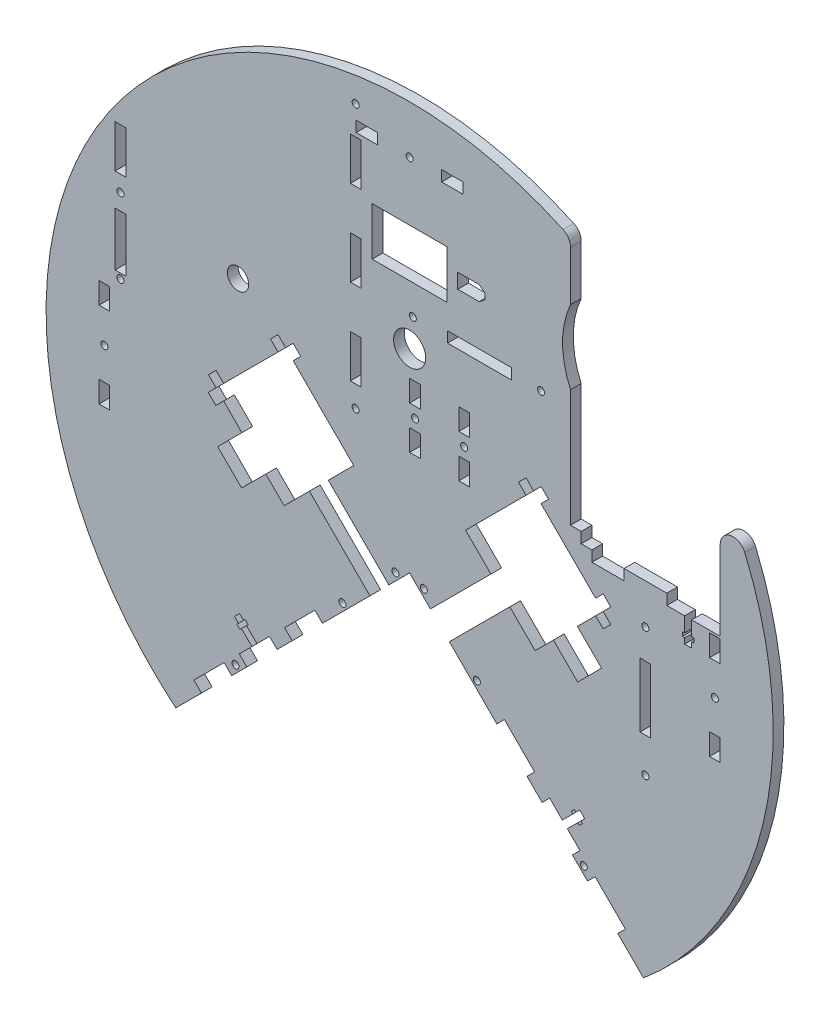
from build123d import *

# Parameters (mm, degrees)
SKETCH1_R                               = 215.9
BOSS_EXTRUDE1_DEPTH                     = 6.35
CUT_EXTRUDE1_DEPTH                      = 306.394732273
CUT_EXTRUDE2_DEPTH                      = 306.394732273
SKETCH4_W                               = 6.35
SKETCH4_H                               = 12.7
CUT_EXTRUDE3_DEPTH                      = 306.394732273
CUT_EXTRUDE4_DEPTH                      = 6.35
LPATTERN1_COUNT                         = 3
LPATTERN1_PITCH                         = 38.1
CUT_EXTRUDE5_DEPTH                      = 6.35
LPATTERN2_COUNT                         = 3
LPATTERN2_PITCH                         = 38.1
SKETCH8_W                               = 6.35
SKETCH8_H                               = 25.4
SKETCH8_H_2                             = 31.84481566
CUT_EXTRUDE7_DEPTH                      = 306.394732273
SKETCH11_R                              = 2.0955
WHEEL_HOLE_DEPTH                        = 306.394732273
SKETCH12_W                              = 44.45
SKETCH12_H                              = 28.575
BATTERY_HOLE_DEPTH                      = 306.394732273
SKETCH13_R                              = 2.0955
CUT_EXTRUDE10_DEPTH                     = 306.394732273
SKETCH14_R                              = 2.0955
CUT_EXTRUDE11_DEPTH                     = 306.394732273
SKETCH15_R                              = 2.0955
CUT_EXTRUDE12_DEPTH                     = 306.394732273
XT60BATTERYHOLE_DEPTH                   = 306.394732273
SKETCH22_R                              = 9.525
WIRE_HOLE_FOR_SERVO_AND_TOP_COMPS_DEPTH = 306.394732273
SKETCH23_W                              = 6.35
SKETCH23_H                              = 12.7
CAMERAMOUNTTABHOLES_DEPTH               = 306.394732273
SKETCH24_R                              = 2.0955
CUT_EXTRUDE18_DEPTH                     = 306.394732273
SKETCH25_W                              = 12.7
SKETCH25_H                              = 6.35
CUT_EXTRUDE19_DEPTH                     = 306.394732273
SKETCH26_R                              = 2.0955
CUT_EXTRUDE20_DEPTH                     = 306.394732273
CUT_EXTRUDE24_DEPTH                     = 306.394732273
CUT_EXTRUDE25_DEPTH                     = 306.394732273
CUT_EXTRUDE28_DEPTH                     = 306.394732273
FILLET2_R                               = 7.62
SKETCH36_W                              = 6.35
SKETCH36_H                              = 12.7
BOSS_EXTRUDE8_DEPTH                     = 6.35
SKETCH37_W                              = 6.35
SKETCH37_H                              = 6.35
BOSS_EXTRUDE9_DEPTH                     = 6.35
CUT_EXTRUDE29_DEPTH                     = 306.394732273
CUT_EXTRUDE30_DEPTH                     = 306.394732273
SKETCH40_W                              = 25.389250947
SKETCH40_H                              = 6.35
BOSS_EXTRUDE10_DEPTH                    = 6.35
CUT_EXTRUDE31_DEPTH                     = 306.394732273
SKETCH42_W                              = 6.35
SKETCH42_H                              = 38.1
CUT_EXTRUDE32_DEPTH                     = 306.394732273
SKETCH43_R                              = 2.0955
CUT_EXTRUDE33_DEPTH                     = 306.394732273
SKETCH44_R                              = 2.0955
CUT_EXTRUDE34_DEPTH                     = 306.394732273
SKETCH45_W                              = 38.1
SKETCH45_H                              = 6.35
CUT_EXTRUDE35_DEPTH                     = 306.394732273
SKETCH46_R                              = 6.35
CUT_EXTRUDE36_DEPTH                     = 306.394732273


with BuildPart() as part:
    # Sketch1 → Boss-Extrude1 (new body)
    with BuildSketch(Plane.XY):
        Circle(SKETCH1_R)
    extrude(amount=BOSS_EXTRUDE1_DEPTH)

    # Sketch2 → Cut-Extrude1 (cut, through all)
    with BuildSketch(Plane(origin=(0, 0, 0), x_dir=(-1, 0, 0), z_dir=(0, 0, -1))):
        with BuildLine():
            Line((0, -26.441092948), (138.870288723, -165.311381671))
            ThreePointArc((138.870288723, -165.311381671), (0, -215.9), (-138.870288723, -165.311381671))
            Line((-138.870288723, -165.311381671), (0, -26.441092948))
        make_face()
    extrude(amount=-CUT_EXTRUDE1_DEPTH, mode=Mode.SUBTRACT)

    # Sketch3 → Cut-Extrude2 (cut, through all)
    with BuildSketch(Plane.XY.offset(6.35)):
        Polygon((73.638100193, 52.585160918), (33.226947648, 12.174008373), (48.268876651, -2.86792063), (12.347852166, -38.788945114), (23.573172318, -50.014265265), (59.494196802, -14.093240781), (74.536125805, -29.135169784), (114.94727835, 11.275982761), align=None)
    cut_extrude2 = extrude(amount=-CUT_EXTRUDE2_DEPTH, mode=Mode.SUBTRACT)

    # Mirror1: Cut-Extrude2 across plane
    add(cut_extrude2.mirror(Plane(origin=(0, 0, 0), x_dir=(0, 0, 1), z_dir=(1, 0, 0))), mode=Mode.SUBTRACT)

    # Sketch4 → Cut-Extrude3 (cut, through all)
    with BuildSketch(Plane.XY.offset(6.35)):
        with Locations((181.263437852, -25.4)):
            Rectangle(SKETCH4_W, SKETCH4_H)
        with Locations((181.263437852, 25.4)):
            Rectangle(SKETCH4_W, SKETCH4_H)
        with Locations((-181.263437852, 25.4)):
            Rectangle(SKETCH4_W, SKETCH4_H)
        with Locations((-181.263437852, -25.4)):
            Rectangle(SKETCH4_W, SKETCH4_H)
    extrude(amount=-CUT_EXTRUDE3_DEPTH, mode=Mode.SUBTRACT)

    # Sketch5 → Cut-Extrude4 (cut)
    with BuildSketch(Plane.XY.offset(6.35)):
        Polygon((-128.10574744, -145.566584266), (-110.145235198, -127.606072024), (-105.655107137, -132.096200085), (-123.615619379, -150.056712327), align=None)
    cut_extrude4 = extrude(amount=-CUT_EXTRUDE4_DEPTH, mode=Mode.SUBTRACT)

    # LPattern1: Cut-Extrude4 ×3
    with Locations(*[Vector(0.7071067811865477, 0.7071067811865475, 0) * (i * LPATTERN1_PITCH) for i in range(1, LPATTERN1_COUNT)]):
        add(cut_extrude4, mode=Mode.SUBTRACT)

    # Sketch6 → Cut-Extrude5 (cut)
    with BuildSketch(Plane.XY.offset(6.35)):
        Polygon((110.145235198, -127.606072024), (128.10574744, -145.566584266), (123.615619379, -150.056712327), (105.655107137, -132.096200085), align=None)
    cut_extrude5 = extrude(amount=-CUT_EXTRUDE5_DEPTH, mode=Mode.SUBTRACT)

    # LPattern2: Cut-Extrude5 ×3
    with Locations(*[Vector(-0.7071067811865489, 0.7071067811865461, 0) * (i * LPATTERN2_PITCH) for i in range(1, LPATTERN2_COUNT)]):
        add(cut_extrude5, mode=Mode.SUBTRACT)

    # Sketch8 → Cut-Extrude7 (cut, through all)
    with BuildSketch(Plane(origin=(0, 0, 0), x_dir=(-1, 0, 0), z_dir=(0, 0, -1))):
        with Locations((32.038437852, 169.033338138)):
            Rectangle(SKETCH8_W, SKETCH8_H)
        with Locations((32.038437852, 118.233338138)):
            Rectangle(SKETCH8_W, SKETCH8_H)
        with Locations((32.038437852, 67.433338138)):
            Rectangle(SKETCH8_W, SKETCH8_H)
        with Locations((171.738437852, 105.533338138)):
            Rectangle(SKETCH8_W, SKETCH8_H)
        with Locations((171.738437852, 57.860930308)):
            Rectangle(SKETCH8_W, SKETCH8_H_2)
    extrude(amount=-CUT_EXTRUDE7_DEPTH, mode=Mode.SUBTRACT)

    # Sketch11 → Wheel Hole (cut, through all)
    with BuildSketch(Plane(origin=(0, 0, 0), x_dir=(-1, 0, 0), z_dir=(0, 0, -1))):
        with Locations((181.263437852, 0)):
            Circle(SKETCH11_R)
    wheel_hole = extrude(amount=-WHEEL_HOLE_DEPTH, mode=Mode.SUBTRACT)

    # Mirror2: Wheel Hole across plane
    add(wheel_hole.mirror(Plane(origin=(0, 0, 0), x_dir=(0, 0, 1), z_dir=(1, 0, 0))), mode=Mode.SUBTRACT)

    # Sketch12 → Battery hole (cut, through all)
    with BuildSketch(Plane.XY.offset(6.35)):
        with Locations((0, 138.1125)):
            Rectangle(SKETCH12_W, SKETCH12_H)
    extrude(amount=-BATTERY_HOLE_DEPTH, mode=Mode.SUBTRACT)

    # Sketch13 → Cut-Extrude10 (cut, through all)
    with BuildSketch(Plane(origin=(0, 0, 0), x_dir=(-1, 0, 0), z_dir=(0, 0, -1))):
        with Locations((103.410043107, -125.361007994)):
            Circle(SKETCH13_R)
        with Locations((39.918435395, -61.869400282)):
            Circle(SKETCH13_R)
        with Locations((8.418990113, -30.369955001)):
            Circle(SKETCH13_R)
    cut_extrude10 = extrude(amount=-CUT_EXTRUDE10_DEPTH, mode=Mode.SUBTRACT)

    # Mirror3: Cut-Extrude10 across plane
    add(cut_extrude10.mirror(Plane(origin=(0, 0, 0), x_dir=(0, 0, 1), z_dir=(1, 0, 0))), mode=Mode.SUBTRACT)

    # Sketch14 → Cut-Extrude11 (cut, through all)
    with BuildSketch(Plane.XY.offset(6.35)):
        with Locations((-171.738437852, 83.308338138)):
            Circle(SKETCH14_R)
        with Locations((-171.738437852, 38.858338138)):
            Circle(SKETCH14_R)
    extrude(amount=-CUT_EXTRUDE11_DEPTH, mode=Mode.SUBTRACT)

    # Sketch15 → Cut-Extrude12 (cut, through all)
    with BuildSketch(Plane.XY.offset(6.35)):
        with Locations((-32.038437852, 42.033338138)):
            Circle(SKETCH15_R)
        with Locations((-32.038437852, 198.816669069)):
            Circle(SKETCH15_R)
    extrude(amount=-CUT_EXTRUDE12_DEPTH, mode=Mode.SUBTRACT)

    # Sketch21 → XT60BatteryHole (cut, through all)
    with BuildSketch(Plane.XY.offset(6.35)):
        Polygon((44.831, 139.79525), (41.275, 142.494), (28.575, 142.494), (28.575, 133.731), (41.275, 133.731), (44.831, 136.42975), align=None)
    extrude(amount=-XT60BATTERYHOLE_DEPTH, mode=Mode.SUBTRACT)

    # Sketch22 → Wire Hole for Servo and Top Comps. (cut, through all)
    with BuildSketch(Plane.XY.offset(6.35)):
        with Locations((0, 88.9)):
            Circle(SKETCH22_R)
    extrude(amount=-WIRE_HOLE_FOR_SERVO_AND_TOP_COMPS_DEPTH, mode=Mode.SUBTRACT)

    # Sketch23 → CameraMountTabHoles (cut, through all)
    with BuildSketch(Plane(origin=(0, 0, 0), x_dir=(-1, 0, 0), z_dir=(0, 0, -1))):
        with Locations((-32.385, 41.91)):
            Rectangle(SKETCH23_W, SKETCH23_H)
        with Locations((-32.385, 67.31)):
            Rectangle(SKETCH23_W, SKETCH23_H)
        with Locations((-3.175, 41.91)):
            Rectangle(SKETCH23_W, SKETCH23_H)
        with Locations((-3.175, 67.31)):
            Rectangle(SKETCH23_W, SKETCH23_H)
    extrude(amount=-CAMERAMOUNTTABHOLES_DEPTH, mode=Mode.SUBTRACT)

    # Sketch24 → Cut-Extrude18 (cut, through all)
    with BuildSketch(Plane.XY.offset(6.35)):
        with Locations((32.385, 54.61)):
            Circle(SKETCH24_R)
        with Locations((3.175, 54.61)):
            Circle(SKETCH24_R)
    extrude(amount=-CUT_EXTRUDE18_DEPTH, mode=Mode.SUBTRACT)

    # Sketch25 → Cut-Extrude19 (cut, through all)
    with BuildSketch(Plane.XY.offset(6.35)):
        with Locations((-25.4, 187.325)):
            Rectangle(SKETCH25_W, SKETCH25_H)
        with Locations((25.4, 187.325)):
            Rectangle(SKETCH25_W, SKETCH25_H)
    extrude(amount=-CUT_EXTRUDE19_DEPTH, mode=Mode.SUBTRACT)

    # Sketch26 → Cut-Extrude20 (cut, through all)
    with BuildSketch(Plane(origin=(0, 0, 0), x_dir=(-1, 0, 0), z_dir=(0, 0, -1))):
        with Locations((0, 187.325)):
            Circle(SKETCH26_R)
    extrude(amount=-CUT_EXTRUDE20_DEPTH, mode=Mode.SUBTRACT)

    # Sketch30 → Cut-Extrude24 (cut, through all)
    with BuildSketch(Plane.XY.offset(6.35)):
        Polygon((-93.666465216, -111.127302042), (-90.702980696, -108.163817522), (-96.899357419, -101.967440799), (-95.956430526, -101.024513906), (-97.752481751, -99.228462682), (-98.695408643, -100.171389574), (-101.030275235, -97.836522983), (-103.993759755, -100.800007503), (-101.658893163, -103.134874094), (-102.601820056, -104.077800987), (-100.805768832, -105.873852211), (-99.862841939, -104.930925319), align=None)
    cut_extrude24 = extrude(amount=-CUT_EXTRUDE24_DEPTH, mode=Mode.SUBTRACT)

    # Mirror4: Cut-Extrude24 across plane
    add(cut_extrude24.mirror(Plane(origin=(0, 0, 0), x_dir=(0, 0, 1), z_dir=(1, 0, 0))), mode=Mode.SUBTRACT)

    # Sketch31 → Cut-Extrude25 (cut, through all)
    with BuildSketch(Plane.XY.offset(6.35)):
        Polygon((-99.591040383, -4.080255206), (-85.402235711, -18.269059877), (-99.770645505, -32.637469671), (-113.959450176, -18.448665), align=None)
        Polygon((99.591040383, -4.080255206), (85.402235711, -18.269059877), (99.770645505, -32.637469671), (113.959450176, -18.448665), align=None)
    extrude(amount=-CUT_EXTRUDE25_DEPTH, mode=Mode.SUBTRACT)

    # Sketch35 → Cut-Extrude28 (cut, through all)
    with BuildSketch(Plane.XY.offset(6.35)):
        with BuildLine():
            Line((95.538437852, 33.17632042), (184.438437852, 33.17632042))
            Line((184.438437852, 33.17632042), (184.438437852, 116.87632042))
            ThreePointArc((184.438437852, 116.87632042), (146.330419618, 164.308887008), (95.538437852, 197.808797679))
            Line((95.538437852, 197.808797679), (95.538437852, 121.87632042))
            Line((95.538437852, 121.87632042), (95.538437852, 33.17632042))
        make_face()
    extrude(amount=-CUT_EXTRUDE28_DEPTH, mode=Mode.SUBTRACT)

    # Fillet2
    fillet2_edges = [part.edges().sort_by_distance(p)[0] for p in [
        (184.438437852, 112.228662305, 3.175),
        (95.538437852, 193.610993729, 3.175),
    ]]
    fillet(fillet2_edges, radius=FILLET2_R)

    # Sketch36 → Boss-Extrude8 (add)
    with BuildSketch(Plane(origin=(95.538437852, 0, 0), x_dir=(0, 0, -1), z_dir=(1, 0, 0))):
        with Locations((-3.175, 39.52632042)):
            Rectangle(SKETCH36_W, SKETCH36_H)
    extrude(amount=BOSS_EXTRUDE8_DEPTH)

    # Sketch37 → Boss-Extrude9 (add)
    with BuildSketch(Plane(origin=(101.888437852, 0, 0), x_dir=(0, 0, -1), z_dir=(1, 0, 0))):
        with Locations((-3.175, 36.35132042)):
            Rectangle(SKETCH37_W, SKETCH37_H)
    extrude(amount=BOSS_EXTRUDE9_DEPTH)

    # Sketch38 → Cut-Extrude29 (cut, through all)
    with BuildSketch(Plane.XY.offset(6.35)):
        with BuildLine():
            Line((95.538437852, 159.30810977), (95.538437852, 115.573937206))
            ThreePointArc((95.538437852, 115.573937206), (90.813693084, 137.441023488), (95.538437852, 159.30810977))
        make_face()
    extrude(amount=-CUT_EXTRUDE29_DEPTH, mode=Mode.SUBTRACT)

    # Sketch39 → Cut-Extrude30 (cut, through all)
    with BuildSketch(Plane.XY.offset(6.35)):
        Polygon((119.43740641, 6.7858547), (114.94727835, 11.275982761), (110.457150289, 6.7858547), (114.94727835, 2.29572664), align=None)
        Polygon((110.457150289, 15.766110821), (114.94727835, 11.275982761), (119.43740641, 15.766110821), (114.94727835, 20.256238882), align=None)
        Polygon((78.128228253, 57.075288978), (73.638100193, 52.585160918), (78.001430205, 48.221830906), (82.491558265, 52.711958966), align=None)
        Polygon((69.147972132, 48.095032857), (73.638100193, 52.585160918), (69.147972132, 57.075288978), (64.657844072, 52.585160918), align=None)
        Polygon((-69.147972132, 57.075288978), (-73.638100193, 52.585160918), (-69.147972132, 48.095032857), (-64.657844072, 52.585160918), align=None)
        Polygon((-78.128228253, 48.095032857), (-73.638100193, 52.585160918), (-78.128228253, 57.075288978), (-82.618356314, 52.585160918), align=None)
        Polygon((-119.43740641, 15.766110821), (-114.94727835, 11.275982761), (-110.457150289, 15.766110821), (-114.94727835, 20.256238882), align=None)
        Polygon((-110.457150289, 6.7858547), (-114.94727835, 11.275982761), (-119.565782853, 6.657478257), (-115.075654793, 2.167350197), align=None)
    extrude(amount=-CUT_EXTRUDE30_DEPTH, mode=Mode.SUBTRACT)

    # Sketch40 → Boss-Extrude10 (add)
    with BuildSketch(Plane(origin=(0, 33.17632042, 0), x_dir=(1, 0, 0), z_dir=(0, 1, 0))):
        with Locations((139.993812379, -3.175)):
            Rectangle(SKETCH40_W, SKETCH40_H)
    extrude(amount=BOSS_EXTRUDE10_DEPTH)

    # Sketch41 → Cut-Extrude31 (cut, through all)
    with BuildSketch(Plane.XY.offset(6.35)):
        Polygon((167.483937852, 33.17632042), (163.292937852, 33.17632042), (163.292937852, 24.41332042), (161.959437852, 24.41332042), (161.959437852, 21.87332042), (163.292937852, 21.87332042), (163.292937852, 18.57132042), (167.483937852, 18.57132042), (167.483937852, 21.87332042), (168.817437852, 21.87332042), (168.817437852, 24.41332042), (167.483937852, 24.41332042), align=None)
    extrude(amount=-CUT_EXTRUDE31_DEPTH, mode=Mode.SUBTRACT)

    # Sketch42 → Cut-Extrude32 (cut, through all)
    with BuildSketch(Plane(origin=(0, 0, 0), x_dir=(-1, 0, 0), z_dir=(0, 0, -1))):
        with Locations((-139.988437852, -20.79867958)):
            Rectangle(SKETCH42_W, SKETCH42_H)
    extrude(amount=-CUT_EXTRUDE32_DEPTH, mode=Mode.SUBTRACT)

    # Sketch43 → Cut-Extrude33 (cut, through all)
    with BuildSketch(Plane.XY.offset(6.35)):
        with Locations((139.988437852, 15.71382042)):
            Circle(SKETCH43_R)
        with Locations((139.988437852, -60.48617958)):
            Circle(SKETCH43_R)
    extrude(amount=-CUT_EXTRUDE33_DEPTH, mode=Mode.SUBTRACT)

    # Sketch44 → Cut-Extrude34 (cut, through all)
    with BuildSketch(Plane.XY.offset(6.35)):
        with Locations((78.075937852, 106.20132042)):
            Circle(SKETCH44_R)
        with Locations((1.875937852, 106.20132042)):
            Circle(SKETCH44_R)
    extrude(amount=-CUT_EXTRUDE34_DEPTH, mode=Mode.SUBTRACT)

    # Sketch45 → Cut-Extrude35 (cut, through all)
    with BuildSketch(Plane(origin=(0, 0, 0), x_dir=(-1, 0, 0), z_dir=(0, 0, -1))):
        with Locations((-41.563437852, 106.20132042)):
            Rectangle(SKETCH45_W, SKETCH45_H)
    extrude(amount=-CUT_EXTRUDE35_DEPTH, mode=Mode.SUBTRACT)

    # Sketch46 → Cut-Extrude36 (cut, through all)
    with BuildSketch(Plane.XY.offset(6.35)):
        with Locations((-101.888437852, 74.024820426)):
            Circle(SKETCH46_R)
    extrude(amount=-CUT_EXTRUDE36_DEPTH, mode=Mode.SUBTRACT)


solid = part.part
